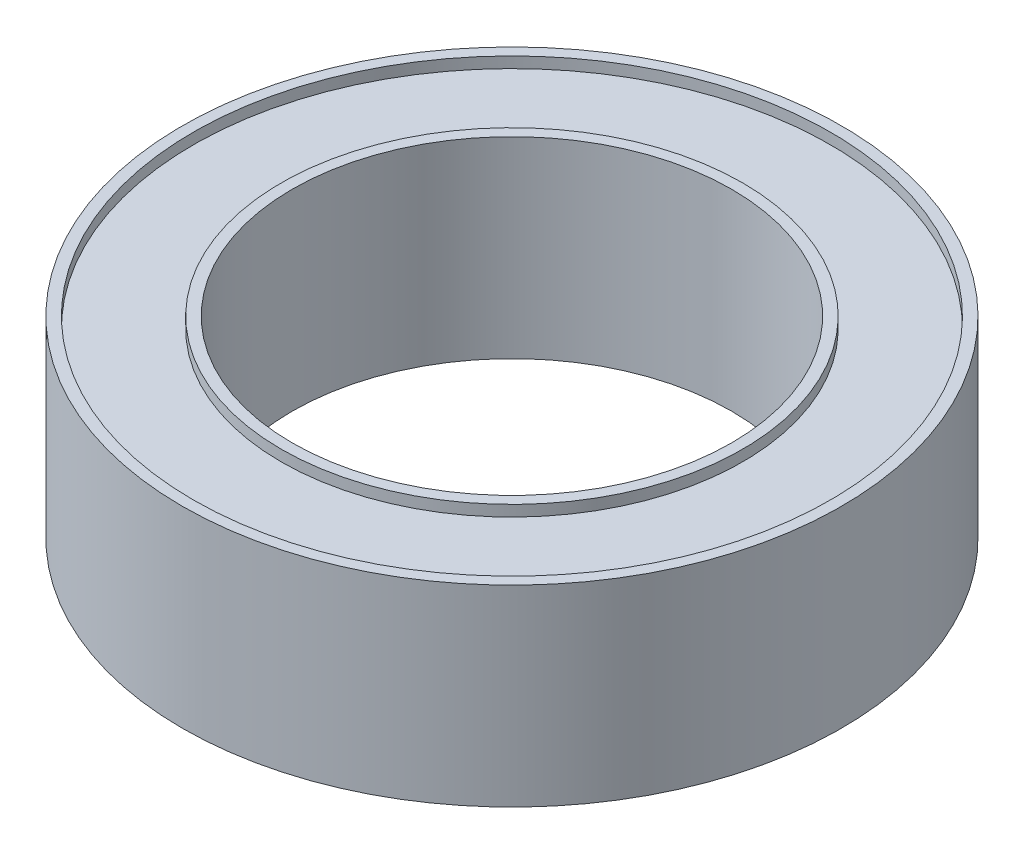
from build123d import *

# Parameters (mm, degrees)
SKETCH1_R           = 6
SKETCH1_R_2         = 4
BOSS_EXTRUDE1_DEPTH = 1.75
SKETCH2_R           = 5.8
SKETCH2_R_2         = 4.2
CUT_EXTRUDE1_DEPTH  = 0.2


with BuildPart() as part:
    # Sketch1 → Boss-Extrude1 (new, symmetric)
    with BuildSketch(Plane(origin=(0, 0, 0), x_dir=(1, 0, 0), z_dir=(0, 1, 0))):
        Circle(SKETCH1_R)
        Circle(SKETCH1_R_2, mode=Mode.SUBTRACT)
    extrude(amount=BOSS_EXTRUDE1_DEPTH, both=True)

    # Sketch2 → Cut-Extrude1 (cut)
    with BuildSketch(Plane(origin=(0, 1.75, 0), x_dir=(1, 0, 0), z_dir=(0, 1, 0))):
        Circle(SKETCH2_R)
        Circle(SKETCH2_R_2, mode=Mode.SUBTRACT)
    cut_extrude1 = extrude(amount=-CUT_EXTRUDE1_DEPTH, mode=Mode.SUBTRACT)

    # Mirror2: Cut-Extrude1 across plane
    add(cut_extrude1.mirror(Plane.ZX), mode=Mode.SUBTRACT)


solid = part.part
